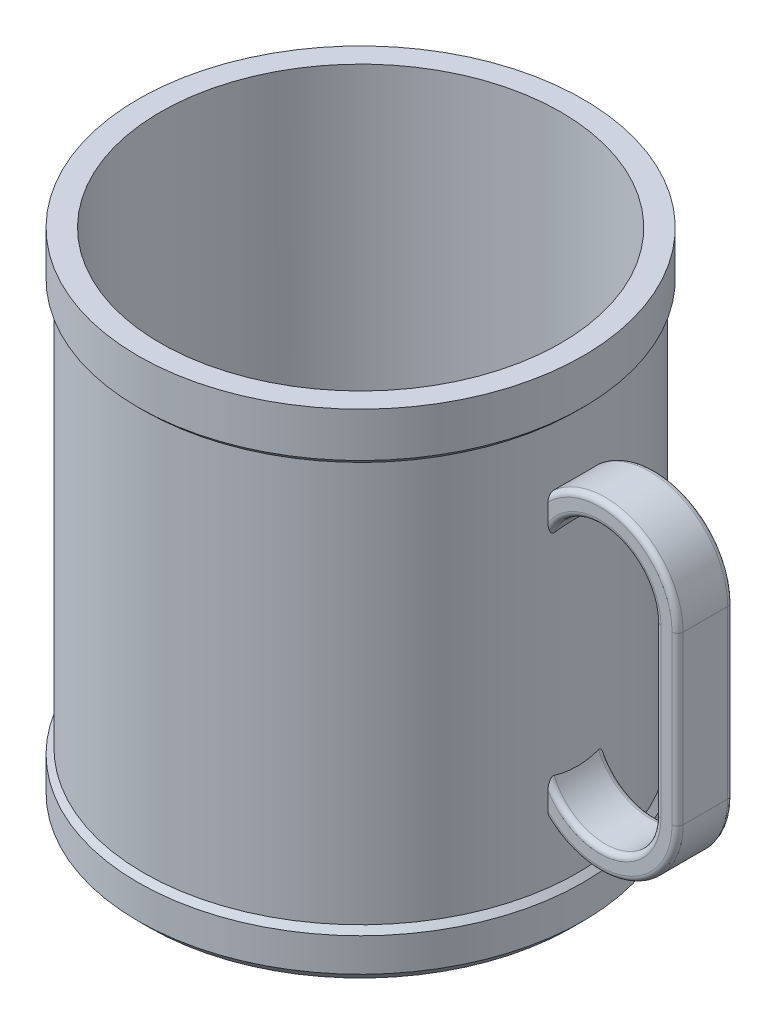
from build123d import *

# Parameters (mm, degrees)
SKETCH1_R               = 39
BOSS_EXTRUDE1_DEPTH     = 90
SHELL3_T                = -3
BOSS_EXTRUDE3_START     = -8
SKETCH6_R               = 40
SKETCH6_R_2             = 39
BOSS_EXTRUDE3_DEPTH     = 8
CHAMFER2_SIZE           = 2
CHAMFER3_SIZE           = 1
CHAMFER4_SIZE           = 1
BOSS_EXTRUDE8_START     = 30
BOSS_EXTRUDE8_OUTLINE_W = 4
BOSS_EXTRUDE8_OUTLINE_H = 10
BOSS_EXTRUDE8_DEPTH     = 29.9999999
BOSS_EXTRUDE8_START_2   = -5
BOSS_EXTRUDE8_2_DEPTH   = 10
CUT_EXTRUDE3_START      = -70
SKETCH11_R              = 36
CUT_EXTRUDE3_DEPTH      = 70
FILLET4_R               = 1
FILLET5_R               = 1


with BuildPart() as part:
    # Sketch1 → Boss-Extrude1 (new body)
    with BuildSketch(Plane(origin=(0, 0, 0), x_dir=(1, 0, 0), z_dir=(0, 1, 0))):
        with Locations(Location((0, 0, 0), (0, 0, 90))):
            Circle(SKETCH1_R)
    extrude(amount=BOSS_EXTRUDE1_DEPTH)

    # Shell3
    shell3_openings = [part.faces().sort_by_distance(p)[0] for p in [
        (0, 90, 0),
    ]]
    offset(amount=SHELL3_T, openings=shell3_openings, kind=Kind.INTERSECTION)

    # Sketch6 → Boss-Extrude3 (add)
    with BuildSketch(Plane(origin=(0, 90, 0), x_dir=(1, 0, 0), z_dir=(0, 1, 0)).offset(BOSS_EXTRUDE3_START)):
        with Locations(Location((0, 0, 0), (0, 0, 270))):
            Circle(SKETCH6_R)
        with Locations(Location((0, 0, 0), (0, 0, 90))):
            Circle(SKETCH6_R_2, mode=Mode.SUBTRACT)
    boss_extrude3 = extrude(amount=BOSS_EXTRUDE3_DEPTH)

    # Mirror1: Boss-Extrude3 across plane
    add(boss_extrude3.mirror(Plane.ZX.offset(45)))

    # Chamfer2
    chamfer2_edges = [part.edges().sort_by_distance(p)[0] for p in [
        (0, 0, -40),
    ]]
    chamfer(chamfer2_edges, length=CHAMFER2_SIZE)

    # Chamfer3
    chamfer3_edges = [part.edges().sort_by_distance(p)[0] for p in [
        (0, 8, 39),
    ]]
    chamfer(chamfer3_edges, length=CHAMFER3_SIZE - 0.0001)  # a hair under: the kernel refuses the full size

    # Chamfer4
    chamfer4_edges = [part.edges().sort_by_distance(p)[0] for p in [
        (0, 82, 39),
    ]]
    chamfer(chamfer4_edges, length=CHAMFER4_SIZE - 0.0001)  # a hair under: the kernel refuses the full size

    # Boss-Extrude8: read off the stored shape, not the designer's step
    # Boss-Extrude8 outline → Boss-Extrude8 (add)
    with BuildSketch(Plane(origin=(0, 0, 0), x_dir=(1, 0, 0), z_dir=(0, 1, 0)).offset(BOSS_EXTRUDE8_START)):
        with BuildLine():
            Line((35.65108694, 5), (34, 5))
            Line((34, 5), (34, -5))
            Line((34, -5), (35.65108694, -5))
            ThreePointArc((35.65108694, -5), (36, 0), (35.65108694, 5))
        make_face()
        with Locations((60, 0)):
            Rectangle(BOSS_EXTRUDE8_OUTLINE_W, BOSS_EXTRUDE8_OUTLINE_H)
    extrude(amount=BOSS_EXTRUDE8_DEPTH)

    # Boss-Extrude8 2 outline → Boss-Extrude8 2 (add)
    with BuildSketch(Plane.XY.offset(BOSS_EXTRUDE8_START_2)):
        with BuildLine():
            Line((37.272505048, 30), (34, 30))
            ThreePointArc((34, 30), (34.509326065, 26.258113205), (36.000245256, 22.788489335))
            Line((36.000245256, 22.788489335), (37.093979465, 20.968545795))
            Line((37.093979465, 20.968545795), (38.678159212, 19.554748241))
            ThreePointArc((38.678159212, 19.554748241), (53.722509457, 17.222954742), (62, 30))
            Line((62, 30), (58, 30))
            ThreePointArc((58, 30), (49.841411431, 20.171001885), (38.678159212, 26.380154103))
            Line((38.678159212, 26.380154103), (37.272505048, 30))
        make_face()
        with BuildLine():
            Line((34, 60), (37.27250501, 59.9999999))
            Line((37.27250501, 59.9999999), (38.678159212, 63.619845897))
            ThreePointArc((38.678159212, 63.619845897), (49.841411431, 69.828998115), (58, 60))
            Line((58, 60), (62, 60))
            ThreePointArc((62, 60), (53.722509457, 72.777045258), (38.678159212, 70.445251759))
            Line((38.678159212, 70.445251759), (37.094524497, 69.031940618))
            Line((37.094524497, 69.031940618), (36.000980999, 67.212734781))
            ThreePointArc((36.000980999, 67.212734781), (34.509516947, 63.742574915), (34, 60))
        make_face()
    extrude(amount=BOSS_EXTRUDE8_2_DEPTH)

    # Sketch11 → Cut-Extrude3 (cut)
    with BuildSketch(Plane(origin=(0, 90, 0), x_dir=(1, 0, 0), z_dir=(0, 1, 0)).offset(CUT_EXTRUDE3_START)):
        with Locations(Location((0, 0, 0), (0, 0, 90))):
            Circle(SKETCH11_R)
    extrude(amount=CUT_EXTRUDE3_DEPTH, mode=Mode.SUBTRACT)

    # Fillet4
    fillet4_edges = [part.edges().sort_by_distance(p)[0] for p in [
        (49.841411431, 69.828998115, -5),
        (58, 44.99999995, -5),
        (53.722509457, 17.222954742, -5),
        (53.722509457, 72.777045258, -5),
        (49.841411431, 20.171001885, 5),
        (49.841411431, 69.828998115, 5),
        (53.722509457, 17.222954742, 5),
        (53.722509457, 72.777045258, 5),
        (49.841411431, 20.171001885, -5),
        (62, 44.99999995, -5),
        (58, 44.99999995, 5),
        (62, 44.99999995, 5),
    ]]
    fillet(fillet4_edges, radius=FILLET4_R)

    # Fillet5
    fillet5_edges = [part.edges().sort_by_distance(p)[0] for p in [
        (0, 3, 36),
    ]]
    fillet(fillet5_edges, radius=FILLET5_R)


solid = part.part
